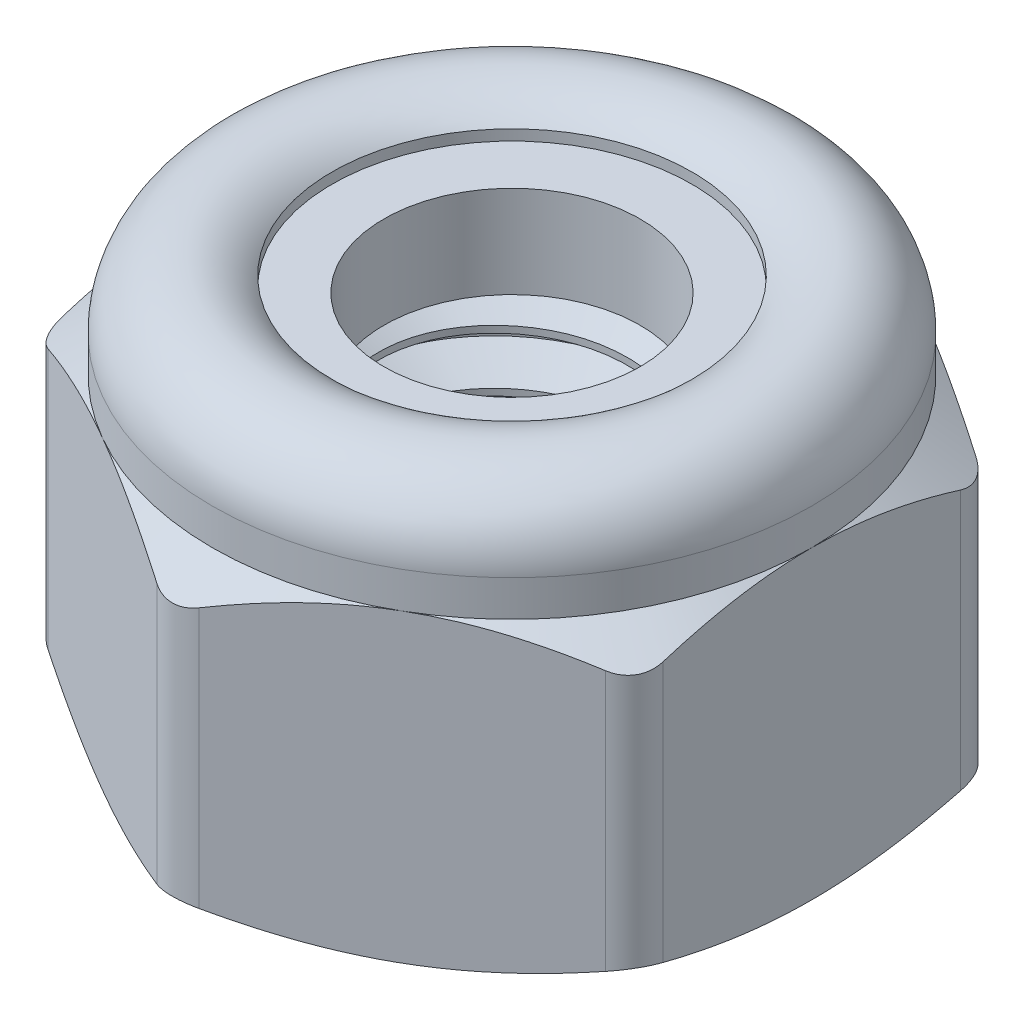
from build123d import *

# Parameters (mm, degrees)
BOSS_EXTRUDE1_DEPTH      = 1.95
BOSS_EXTRUDE1_DEPTH_BACK = 1.95
SKETCH2_R                = 1.175240474
FILLET1_R                = 0.385
SKETCH12_W               = 0.455634919
SKETCH12_H               = 0.883769837
SKETCH4_W                = 0.930394445
SKETCH4_H                = 0.844769837
SKETCH6_W                = 1.475240474
SKETCH6_H                = 2.73
CUT_SWEEP1_PITCH         = 0.5
CUT_SWEEP1_TO            = 2.73
SKETCH10_R               = 1.475240474
BOSS_EXTRUDE2_DEPTH      = 2.73


with BuildPart() as part:
    # Sketch2 → Boss-Extrude1 (new, two sides: drawn at the far end of the back side and taken through both)
    with BuildSketch(Plane(origin=(0, 0, 0), x_dir=(1, 0, 0), z_dir=(0, 1, 0)).offset(-BOSS_EXTRUDE1_DEPTH_BACK)):
        Polygon((0, 3.175426481), (-2.75, 1.58771324), (-2.75, -1.58771324), (0, -3.175426481), (2.75, -1.58771324), (2.75, 1.58771324), align=None)
        with Locations(Location((0, 0, 0), (0, 0, 270))):
            Circle(SKETCH2_R, mode=Mode.SUBTRACT)
    extrude(amount=BOSS_EXTRUDE1_DEPTH + BOSS_EXTRUDE1_DEPTH_BACK)

    # Fillet1
    fillet1_edges = [part.edges().sort_by_distance(p)[0] for p in [
        (2.75, 0, -1.58771324),
        (2.75, 0, 1.58771324),
        (0, 0, 3.175426481),
        (-2.75, 0, 1.58771324),
        (-2.75, 0, -1.58771324),
        (0, 0, -3.175426481),
    ]]
    fillet(fillet1_edges, radius=FILLET1_R)

    # Sketch3 → Cut-Revolve2 (revolve, cut)
    with BuildSketch(Plane(origin=(0, 0, 0), x_dir=(0, 0, -1), z_dir=(1, 0, 0)), mode=Mode.PRIVATE) as cut_revolve2_sk:
        with BuildLine():
            Line((3.175426481, 0.975), (3.175426481, 2.95))
            Line((3.175426481, 2.95), (1.175240474, 2.95))
            Line((1.175240474, 2.95), (1.175240474, 0.78))
            Line((1.175240474, 0.78), (1.65, 0.78))
            Line((1.65, 0.78), (1.65, 1.761269837))
            ThreePointArc((1.65, 1.761269837), (2.35222276, 1.900950629), (2.75, 1.305634919))
            Line((2.75, 1.305634919), (2.75, 0.975))
            Line((2.75, 0.975), (3.175426481, 0.677113171))
            Line((3.175426481, 0.677113171), (3.175426481, 0.975))
        make_face()
        Polygon((2.53, -1.95), (3.175426481, -1.577362848), (3.175426481, -1.95), align=None)
        Polygon((1.175240474, -1.95), (1.175240474, -1.65), (1.475240474, -1.95), align=None)
    revolve(cut_revolve2_sk.sketch.rotate(Axis((0, -1.95, 0), (0, 1, 0)), 270), axis=Axis((0, -1.95, 0), (0, 1, 0)), mode=Mode.SUBTRACT)

    # Sketch12 → Cut-Revolve3 (revolve, cut)
    with BuildSketch(Plane(origin=(0, 0, 0), x_dir=(0, 0, -1), z_dir=(1, 0, 0)), mode=Mode.PRIVATE) as cut_revolve3_sk:
        with Locations((1.87781746, 1.221884919)):
            Rectangle(SKETCH12_W, SKETCH12_H)
    revolve(cut_revolve3_sk.sketch.rotate(Axis((0, 1.95, 0), (0, -1, 0)), 90), axis=Axis((0, 1.95, 0), (0, -1, 0)), mode=Mode.SUBTRACT)

    # Sketch10 → Boss-Extrude2 (add)
    with BuildSketch(Plane.XZ.offset(1.95)):
        Circle(SKETCH10_R)
    extrude(amount=-BOSS_EXTRUDE2_DEPTH)


with BuildPart() as body_2:
    # Sketch4 → Revolve1 (revolve)
    with BuildSketch(Plane(origin=(0, 0, 0), x_dir=(0, 0, -1), z_dir=(1, 0, 0)), mode=Mode.PRIVATE) as revolve1_sk:
        with Locations((1.640437697, 1.202384918)):
            Rectangle(SKETCH4_W, SKETCH4_H)
    revolve(revolve1_sk.sketch.rotate(Axis((0, -1.95, 0), (0, 1, 0)), 270), axis=Axis((0, -1.95, 0), (0, 1, 0)))


with BuildPart() as body_3:
    # Sketch6 → Revolve2 (revolve)
    with BuildSketch(Plane(origin=(0, 0, 0), x_dir=(0, 0, -1), z_dir=(1, 0, 0)), mode=Mode.PRIVATE) as revolve2_sk:
        with Locations((0.737620237, -0.585)):
            Rectangle(SKETCH6_W, SKETCH6_H)
    revolve(revolve2_sk.sketch.rotate(Axis((0, -1.95, 0), (0, 1, 0)), 116.405374441), axis=Axis((0, -1.95, 0), (0, 1, 0)))

    # Cut-Sweep1: arcs per turn and ends read off the stored shape
    # Cut-Sweep1: the profile of Sketch8 screwed along a right-hand helix through 8.799997 turns, 6 arcs to a turn; built about Z, then put on its axis
    cut_sweep1_z = Axis((0, 0, 0), (0, 0, 1))
    cut_sweep1_corners = [(1.150480947, 0, -0.6875), (1.150480947, 0, -0.75), (1.502303767, 0, -0.953125), (1.529367061, 0, -0.46875)]
    with BuildLine(mode=Mode.PRIVATE) as cut_sweep1_profile:
        Line(cut_sweep1_corners[0], cut_sweep1_corners[1])
        Line(cut_sweep1_corners[1], cut_sweep1_corners[2])
        Line(cut_sweep1_corners[2], cut_sweep1_corners[3])
        Line(cut_sweep1_corners[3], cut_sweep1_corners[0])
    cut_sweep1_cap = Face(cut_sweep1_profile.wire())
    cut_sweep1_turn_angles = [0, 30, 60, 90, 120, 150, 180, 210, 240, 270, 300, 330, 360]
    cut_sweep1_turn_weights = [1, 0.8660254037844387, 1, 0.8660254037844387, 1, 0.8660254037844387, 1, 0.8660254037844387, 1, 0.8660254037844387, 1, 0.8660254037844387, 1]
    cut_sweep1_turn_rails = [Edge.make_bspline([Vector(p[0], p[1], 0).rotate(cut_sweep1_z, cut_sweep1_turn_angles[k]) / cut_sweep1_turn_weights[k] + Vector(0, 0, p[2] + CUT_SWEEP1_PITCH * cut_sweep1_turn_angles[k] / 360) for k in range(13)], [0, 0, 0, 1, 1, 2, 2, 3, 3, 4, 4, 5, 5, 6, 6, 6], 2, cut_sweep1_turn_weights) for p in cut_sweep1_corners]
    cut_sweep1_turn_sides = [Face.make_surface_from_curves(cut_sweep1_turn_rails[p[0]], cut_sweep1_turn_rails[p[1]]) for p in [(0, 1), (1, 2), (2, 3), (3, 0)]]
    cut_sweep1_last_angles = [2880, 2910, 2940, 2970, 3000, 3030, 3060, 3090, 3120, 3143.9995, 3167.999]
    cut_sweep1_last_weights = [1, 0.8660254037844387, 1, 0.8660254037844387, 1, 0.8660254037844387, 1, 0.8660254037844387, 1, 0.9135490070546214, 1]
    cut_sweep1_last_rails = [Edge.make_bspline([Vector(p[0], p[1], 0).rotate(cut_sweep1_z, cut_sweep1_last_angles[k]) / cut_sweep1_last_weights[k] + Vector(0, 0, p[2] + CUT_SWEEP1_PITCH * cut_sweep1_last_angles[k] / 360) for k in range(11)], [0, 0, 0, 1, 1, 2, 2, 3, 3, 4, 4, 5, 5, 5], 2, cut_sweep1_last_weights) for p in cut_sweep1_corners]
    cut_sweep1_last_sides = [Face.make_surface_from_curves(cut_sweep1_last_rails[p[0]], cut_sweep1_last_rails[p[1]]) for p in [(0, 1), (1, 2), (2, 3), (3, 0)]]
    cut_sweep1 = Plane(origin=(0, -1.95, 0), x_dir=(1, 0, 0), z_dir=(0, 1, 0)) * split(Solid(Shell([*[p.moved(Location((0, 0, CUT_SWEEP1_PITCH * i))) for i in range(8) for p in cut_sweep1_turn_sides], *cut_sweep1_last_sides, cut_sweep1_cap, cut_sweep1_cap.rotate(cut_sweep1_z, 3167.999).moved(Location((0, 0, CUT_SWEEP1_PITCH * 3167.999 / 360)))])), bisect_by=Plane.XY.offset(CUT_SWEEP1_TO), keep=Keep.BOTTOM, mode=Mode.PRIVATE)
    add(cut_sweep1, mode=Mode.SUBTRACT)

    # Sketch9 → Revolve3 (revolve)
    with BuildSketch(Plane.XY, mode=Mode.PRIVATE) as revolve3_sk:
        Polygon((0, -0.45), (0, -1.95), (1.5, -1.95), align=None)
    revolve(revolve3_sk.sketch.rotate(Axis((0, -0.45, 0), (0, -1, 0)), 341.705756865), axis=Axis((0, -0.45, 0), (0, -1, 0)))


with BuildPart() as part_1:
    add(part.part)

    # Combine1: cut body 3
    add(body_3.part, mode=Mode.SUBTRACT)


solid = Compound([body_2.part, part_1.part])
